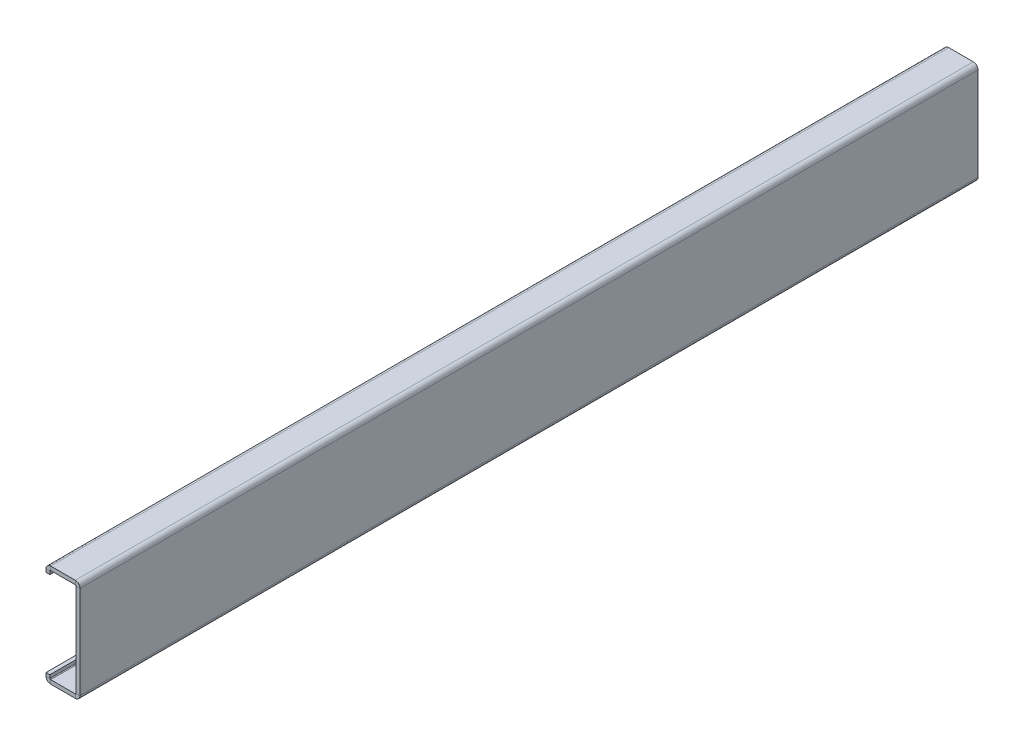
from build123d import *

# Parameters (mm, degrees)
SM_BASE_FLANGE_1_DEPTH = 115


# Sheet-metal steps are written as plain solids
with BuildPart() as part:
    # Sketch 1 → Базовая кромка1 (new, symmetric)
    with BuildSketch(Plane.XY):
        with BuildLine():
            Line((-8.7, 11.1), (-8.7, 11.9))
            ThreePointArc((-8.7, 11.9), (-8.348528137, 12.748528137), (-7.5, 13.1))
            Line((-7.5, 13.1), (-1.2, 13.1))
            ThreePointArc((-1.2, 13.1), (-0.351471863, 12.748528137), (0, 11.9))
            Line((0, 11.9), (0, -11.9))
            ThreePointArc((0, -11.9), (-0.351471863, -12.748528137), (-1.2, -13.1))
            Line((-1.2, -13.1), (-7.5, -13.1))
            ThreePointArc((-7.5, -13.1), (-8.348528137, -12.748528137), (-8.7, -11.9))
            Line((-8.7, -11.9), (-8.7, -11.1))
            Line((-8.7, -11.1), (-7.7, -11.1))
            Line((-7.7, -11.1), (-7.7, -11.9))
            ThreePointArc((-7.7, -11.9), (-7.641421356, -12.041421356), (-7.5, -12.1))
            Line((-7.5, -12.1), (-1.2, -12.1))
            ThreePointArc((-1.2, -12.1), (-1.058578644, -12.041421356), (-1, -11.9))
            Line((-1, -11.9), (-1, 11.9))
            ThreePointArc((-1, 11.9), (-1.058578644, 12.041421356), (-1.2, 12.1))
            Line((-1.2, 12.1), (-7.5, 12.1))
            ThreePointArc((-7.5, 12.1), (-7.641421356, 12.041421356), (-7.7, 11.9))
            Line((-7.7, 11.9), (-7.7, 11.1))
            Line((-7.7, 11.1), (-8.7, 11.1))
        make_face()
    extrude(amount=SM_BASE_FLANGE_1_DEPTH, both=True)


solid = part.part
